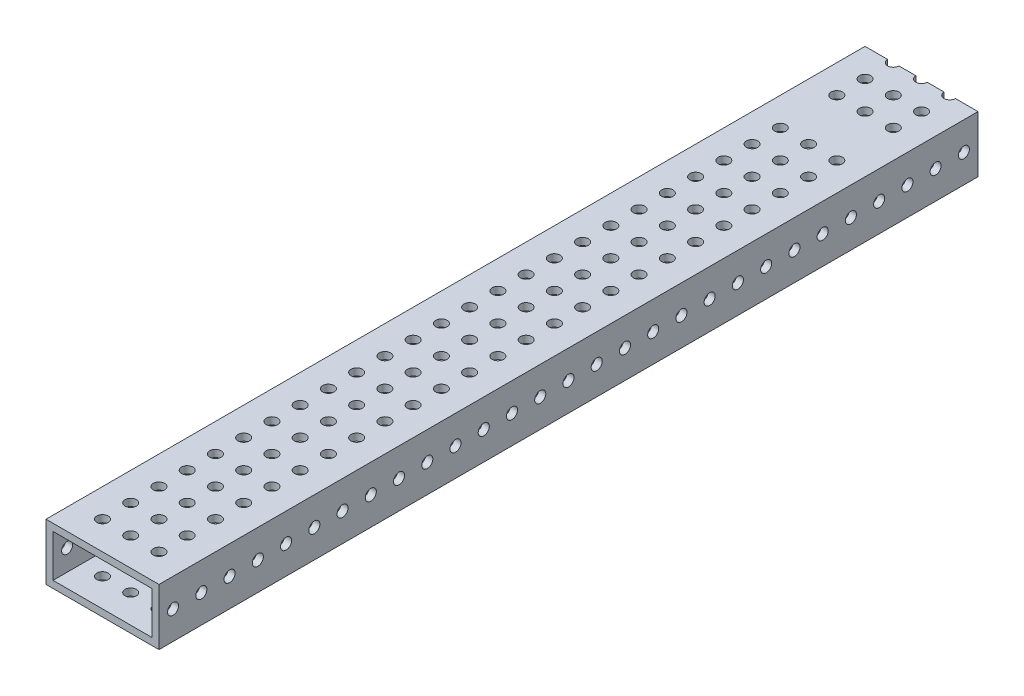
from build123d import *

# Parameters (mm, degrees)
SKETCH1_W           = 50.8
SKETCH1_H           = 25.4
SKETCH1_W_2         = 44.45
SKETCH1_H_2         = 19.05
BOSS_EXTRUDE1_DEPTH = 184.15
SKETCH2_R           = 2.5527
CUT_EXTRUDE1_DEPTH  = 188.620741124
SKETCH4_R           = 2.4892
CUT_EXTRUDE3_DEPTH  = 192.450130582


with BuildPart() as part:
    # Sketch1 → Boss-Extrude1 (new, symmetric)
    with BuildSketch(Plane.XY):
        Rectangle(SKETCH1_W, SKETCH1_H)
        Rectangle(SKETCH1_W_2, SKETCH1_H_2, mode=Mode.SUBTRACT)
    extrude(amount=BOSS_EXTRUDE1_DEPTH, both=True)

    # Sketch2 → Cut-Extrude1 (cut, through all)
    with BuildSketch(Plane(origin=(0, 12.7, 0), x_dir=(1, 0, 0), z_dir=(0, 1, 0))):
        with Locations((0, -171.45)):
            Circle(SKETCH2_R)
        with Locations((12.7, -171.45)):
            Circle(SKETCH2_R)
        with Locations((-12.7, -171.45)):
            Circle(SKETCH2_R)
        with Locations((-12.7, -158.75)):
            Circle(SKETCH2_R)
        with Locations((0, -158.75)):
            Circle(SKETCH2_R)
        with Locations((12.7, -158.75)):
            Circle(SKETCH2_R)
        with Locations((-12.7, -146.05)):
            Circle(SKETCH2_R)
        with Locations((0, -146.05)):
            Circle(SKETCH2_R)
        with Locations((12.7, -146.05)):
            Circle(SKETCH2_R)
        with Locations((-12.7, -133.35)):
            Circle(SKETCH2_R)
        with Locations((0, -133.35)):
            Circle(SKETCH2_R)
        with Locations((12.7, -133.35)):
            Circle(SKETCH2_R)
        with Locations((-12.7, -120.65)):
            Circle(SKETCH2_R)
        with Locations((0, -120.65)):
            Circle(SKETCH2_R)
        with Locations((12.7, -120.65)):
            Circle(SKETCH2_R)
        with Locations((-12.7, -107.95)):
            Circle(SKETCH2_R)
        with Locations((0, -107.95)):
            Circle(SKETCH2_R)
        with Locations((12.7, -107.95)):
            Circle(SKETCH2_R)
        with Locations((-12.7, -95.25)):
            Circle(SKETCH2_R)
        with Locations((0, -95.25)):
            Circle(SKETCH2_R)
        with Locations((12.7, -95.25)):
            Circle(SKETCH2_R)
        with Locations((-12.7, -82.55)):
            Circle(SKETCH2_R)
        with Locations((0, -82.55)):
            Circle(SKETCH2_R)
        with Locations((12.7, -82.55)):
            Circle(SKETCH2_R)
        with Locations((-12.7, -69.85)):
            Circle(SKETCH2_R)
        with Locations((0, -69.85)):
            Circle(SKETCH2_R)
        with Locations((12.7, -69.85)):
            Circle(SKETCH2_R)
        with Locations((-12.7, -57.15)):
            Circle(SKETCH2_R)
        with Locations((0, -57.15)):
            Circle(SKETCH2_R)
        with Locations((12.7, -57.15)):
            Circle(SKETCH2_R)
        with Locations((-12.7, -44.45)):
            Circle(SKETCH2_R)
        with Locations((0, -44.45)):
            Circle(SKETCH2_R)
        with Locations((12.7, -44.45)):
            Circle(SKETCH2_R)
        with Locations((-12.7, -31.75)):
            Circle(SKETCH2_R)
        with Locations((0, -31.75)):
            Circle(SKETCH2_R)
        with Locations((12.7, -31.75)):
            Circle(SKETCH2_R)
        with Locations((-12.7, -19.05)):
            Circle(SKETCH2_R)
        with Locations((0, -19.05)):
            Circle(SKETCH2_R)
        with Locations((12.7, -19.05)):
            Circle(SKETCH2_R)
        with Locations((-12.7, -6.35)):
            Circle(SKETCH2_R)
        with Locations((0, -6.35)):
            Circle(SKETCH2_R)
        with Locations((12.7, -6.35)):
            Circle(SKETCH2_R)
        with Locations((-12.7, 6.35)):
            Circle(SKETCH2_R)
        with Locations((0, 6.35)):
            Circle(SKETCH2_R)
        with Locations((12.7, 6.35)):
            Circle(SKETCH2_R)
        with Locations((-12.7, 19.05)):
            Circle(SKETCH2_R)
        with Locations((0, 19.05)):
            Circle(SKETCH2_R)
        with Locations((12.7, 19.05)):
            Circle(SKETCH2_R)
        with Locations((-12.7, 31.75)):
            Circle(SKETCH2_R)
        with Locations((0, 31.75)):
            Circle(SKETCH2_R)
        with Locations((12.7, 31.75)):
            Circle(SKETCH2_R)
        with Locations((-12.7, 44.45)):
            Circle(SKETCH2_R)
        with Locations((0, 44.45)):
            Circle(SKETCH2_R)
        with Locations((12.7, 44.45)):
            Circle(SKETCH2_R)
        with Locations((-12.7, 57.15)):
            Circle(SKETCH2_R)
        with Locations((0, 57.15)):
            Circle(SKETCH2_R)
        with Locations((12.7, 57.15)):
            Circle(SKETCH2_R)
        with Locations((-12.7, 69.85)):
            Circle(SKETCH2_R)
        with Locations((0, 69.85)):
            Circle(SKETCH2_R)
        with Locations((12.7, 69.85)):
            Circle(SKETCH2_R)
        with Locations((-12.7, 82.55)):
            Circle(SKETCH2_R)
        with Locations((0, 82.55)):
            Circle(SKETCH2_R)
        with Locations((12.7, 82.55)):
            Circle(SKETCH2_R)
        with Locations((-12.7, 95.25)):
            Circle(SKETCH2_R)
        with Locations((0, 95.25)):
            Circle(SKETCH2_R)
        with Locations((12.7, 95.25)):
            Circle(SKETCH2_R)
        with Locations((-12.7, 107.95)):
            Circle(SKETCH2_R)
        with Locations((0, 107.95)):
            Circle(SKETCH2_R)
        with Locations((12.7, 107.95)):
            Circle(SKETCH2_R)
        with Locations((-12.7, 120.65)):
            Circle(SKETCH2_R)
        with Locations((0, 120.65)):
            Circle(SKETCH2_R)
        with Locations((12.7, 120.65)):
            Circle(SKETCH2_R)
        with Locations((-12.7, 133.35)):
            Circle(SKETCH2_R)
        with Locations((0, 133.35)):
            Circle(SKETCH2_R)
        with Locations((12.7, 133.35)):
            Circle(SKETCH2_R)
        with Locations((-12.7, 158.75)):
            Circle(SKETCH2_R)
        with Locations((0, 158.75)):
            Circle(SKETCH2_R)
        with Locations((12.7, 158.75)):
            Circle(SKETCH2_R)
        with Locations((-12.7, 171.45)):
            Circle(SKETCH2_R)
        with Locations((0, 171.45)):
            Circle(SKETCH2_R)
        with Locations((12.7, 171.45)):
            Circle(SKETCH2_R)
        with Locations((-12.7, 184.15)):
            Circle(SKETCH2_R)
        with Locations((0, 184.15)):
            Circle(SKETCH2_R)
        with Locations((12.7, 184.15)):
            Circle(SKETCH2_R)
        with Locations((-12.7, 196.85)):
            Circle(SKETCH2_R)
        with Locations((0, 196.85)):
            Circle(SKETCH2_R)
        with Locations((12.7, 196.85)):
            Circle(SKETCH2_R)
        with Locations((-12.7, 209.55)):
            Circle(SKETCH2_R)
        with Locations((0, 209.55)):
            Circle(SKETCH2_R)
        with Locations((12.7, 209.55)):
            Circle(SKETCH2_R)
        with Locations((-12.7, 222.25)):
            Circle(SKETCH2_R)
        with Locations((0, 222.25)):
            Circle(SKETCH2_R)
        with Locations((12.7, 222.25)):
            Circle(SKETCH2_R)
        with Locations((-12.7, 234.95)):
            Circle(SKETCH2_R)
        with Locations((0, 234.95)):
            Circle(SKETCH2_R)
        with Locations((12.7, 234.95)):
            Circle(SKETCH2_R)
        with Locations((-12.7, 247.65)):
            Circle(SKETCH2_R)
        with Locations((0, 247.65)):
            Circle(SKETCH2_R)
        with Locations((12.7, 247.65)):
            Circle(SKETCH2_R)
        with Locations((12.7, 260.35)):
            Circle(SKETCH2_R)
        with Locations((0, 260.35)):
            Circle(SKETCH2_R)
        with Locations((-12.7, 260.35)):
            Circle(SKETCH2_R)
        with Locations((12.7, 273.05)):
            Circle(SKETCH2_R)
        with Locations((0, 273.05)):
            Circle(SKETCH2_R)
        with Locations((-12.7, 273.05)):
            Circle(SKETCH2_R)
        with Locations((12.7, 285.75)):
            Circle(SKETCH2_R)
        with Locations((0, 285.75)):
            Circle(SKETCH2_R)
        with Locations((-12.7, 285.75)):
            Circle(SKETCH2_R)
        with Locations((12.7, 298.45)):
            Circle(SKETCH2_R)
        with Locations((0, 298.45)):
            Circle(SKETCH2_R)
        with Locations((-12.7, 298.45)):
            Circle(SKETCH2_R)
        with Locations((12.7, 311.15)):
            Circle(SKETCH2_R)
        with Locations((0, 311.15)):
            Circle(SKETCH2_R)
        with Locations((-12.7, 311.15)):
            Circle(SKETCH2_R)
        with Locations((12.7, 323.85)):
            Circle(SKETCH2_R)
        with Locations((0, 323.85)):
            Circle(SKETCH2_R)
        with Locations((-12.7, 323.85)):
            Circle(SKETCH2_R)
        with Locations((12.7, 336.55)):
            Circle(SKETCH2_R)
        with Locations((0, 336.55)):
            Circle(SKETCH2_R)
        with Locations((-12.7, 336.55)):
            Circle(SKETCH2_R)
        with Locations((12.7, 349.25)):
            Circle(SKETCH2_R)
        with Locations((0, 349.25)):
            Circle(SKETCH2_R)
        with Locations((-12.7, 349.25)):
            Circle(SKETCH2_R)
        with Locations((12.7, 361.95)):
            Circle(SKETCH2_R)
        with Locations((0, 361.95)):
            Circle(SKETCH2_R)
        with Locations((-12.7, 361.95)):
            Circle(SKETCH2_R)
        with Locations((12.7, 374.65)):
            Circle(SKETCH2_R)
        with Locations((0, 374.65)):
            Circle(SKETCH2_R)
        with Locations((-12.7, 374.65)):
            Circle(SKETCH2_R)
        with Locations((12.7, 387.35)):
            Circle(SKETCH2_R)
        with Locations((0, 387.35)):
            Circle(SKETCH2_R)
        with Locations((-12.7, 387.35)):
            Circle(SKETCH2_R)
        with Locations((12.7, 400.05)):
            Circle(SKETCH2_R)
        with Locations((0, 400.05)):
            Circle(SKETCH2_R)
        with Locations((-12.7, 400.05)):
            Circle(SKETCH2_R)
        with Locations((12.7, 412.75)):
            Circle(SKETCH2_R)
        with Locations((0, 412.75)):
            Circle(SKETCH2_R)
        with Locations((-12.7, 412.75)):
            Circle(SKETCH2_R)
    extrude(amount=-CUT_EXTRUDE1_DEPTH, mode=Mode.SUBTRACT)

    # Sketch4 → Cut-Extrude3 (cut, through all)
    with BuildSketch(Plane(origin=(25.4, 0, 0), x_dir=(0, 0, -1), z_dir=(1, 0, 0))):
        with Locations((-177.8, 0)):
            Circle(SKETCH4_R)
        with Locations((-165.1, 0)):
            Circle(SKETCH4_R)
        with Locations((-152.4, 0)):
            Circle(SKETCH4_R)
        with Locations((-139.7, 0)):
            Circle(SKETCH4_R)
        with Locations((-127, 0)):
            Circle(SKETCH4_R)
        with Locations((254, 0)):
            Circle(SKETCH4_R)
        with Locations((266.7, 0)):
            Circle(SKETCH4_R)
        with Locations((279.4, 0)):
            Circle(SKETCH4_R)
        with Locations((292.1, 0)):
            Circle(SKETCH4_R)
        with Locations((304.8, 0)):
            Circle(SKETCH4_R)
        with Locations((317.5, 0)):
            Circle(SKETCH4_R)
        with Locations((330.2, 0)):
            Circle(SKETCH4_R)
        with Locations((342.9, 0)):
            Circle(SKETCH4_R)
        with Locations((355.6, 0)):
            Circle(SKETCH4_R)
        with Locations((368.3, 0)):
            Circle(SKETCH4_R)
        with Locations((381, 0)):
            Circle(SKETCH4_R)
        with Locations((393.7, 0)):
            Circle(SKETCH4_R)
        with Locations((406.4, 0)):
            Circle(SKETCH4_R)
        with Locations((419.1, 0)):
            Circle(SKETCH4_R)
        with Locations((-114.3, 0)):
            Circle(SKETCH4_R)
        with Locations((-101.6, 0)):
            Circle(SKETCH4_R)
        with Locations((-88.9, 0)):
            Circle(SKETCH4_R)
        with Locations((-76.2, 0)):
            Circle(SKETCH4_R)
        with Locations((-63.5, 0)):
            Circle(SKETCH4_R)
        with Locations((-50.8, 0)):
            Circle(SKETCH4_R)
        with Locations((-38.1, 0)):
            Circle(SKETCH4_R)
        with Locations((-25.4, 0)):
            Circle(SKETCH4_R)
        with Locations((-12.7, 0)):
            Circle(SKETCH4_R)
        Circle(SKETCH4_R)
        with Locations((12.7, 0)):
            Circle(SKETCH4_R)
        with Locations((25.4, 0)):
            Circle(SKETCH4_R)
        with Locations((38.1, 0)):
            Circle(SKETCH4_R)
        with Locations((50.8, 0)):
            Circle(SKETCH4_R)
        with Locations((63.5, 0)):
            Circle(SKETCH4_R)
        with Locations((76.2, 0)):
            Circle(SKETCH4_R)
        with Locations((88.9, 0)):
            Circle(SKETCH4_R)
        with Locations((101.6, 0)):
            Circle(SKETCH4_R)
        with Locations((114.3, 0)):
            Circle(SKETCH4_R)
        with Locations((127, 0)):
            Circle(SKETCH4_R)
        with Locations((139.7, 0)):
            Circle(SKETCH4_R)
        with Locations((152.4, 0)):
            Circle(SKETCH4_R)
        with Locations((165.1, 0)):
            Circle(SKETCH4_R)
        with Locations((177.8, 0)):
            Circle(SKETCH4_R)
        with Locations((190.5, 0)):
            Circle(SKETCH4_R)
        with Locations((203.2, 0)):
            Circle(SKETCH4_R)
        with Locations((215.9, 0)):
            Circle(SKETCH4_R)
        with Locations((228.6, 0)):
            Circle(SKETCH4_R)
        with Locations((241.3, 0)):
            Circle(SKETCH4_R)
    extrude(amount=-CUT_EXTRUDE3_DEPTH, mode=Mode.SUBTRACT)


solid = part.part
